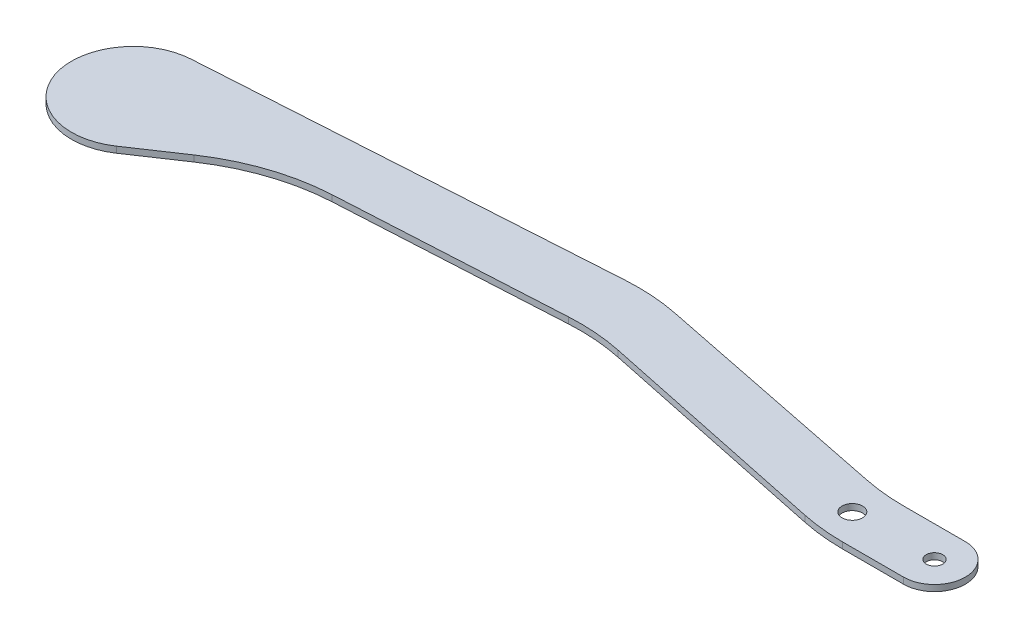
from build123d import *

# Parameters (mm, degrees)
SKETCH1_R           = 5
SKETCH1_R_2         = 4
BOSS_EXTRUDE1_DEPTH = 3
FILLET1_R           = 100


with BuildPart() as part:
    # Sketch1 → Boss-Extrude1 (new body)
    with BuildSketch(Plane(origin=(0, 0, 0), x_dir=(1, 0, 0), z_dir=(0, 1, 0))):
        with BuildLine():
            Line((-138.053278996, 13.889014505), (-5.919683, -13.782501703))
            Line((-5.919683, -13.782501703), (0, -15))
            Line((0, -15), (40, -15))
            ThreePointArc((40, -15), (55, 0), (40, 15))
            Line((40, 15), (0, 15))
            Line((0, 15), (-139.784941349, 43.225909045))
            Line((-139.784941349, 43.225909045), (-351.875415017, 29.941322925))
            ThreePointArc((-351.875415017, 29.941322925), (-378.412739548, -9.628926804), (-333.285739517, -24.912516864))
            Line((-333.285739517, -24.912516864), (-287.823465989, 5.588948968))
            Line((-287.823465989, 5.588948968), (-138.053278996, 13.889014505))
        make_face()
        Circle(SKETCH1_R, mode=Mode.SUBTRACT)
        with Locations((40, 0)):
            Circle(SKETCH1_R_2, mode=Mode.SUBTRACT)
    extrude(amount=BOSS_EXTRUDE1_DEPTH)

    # Fillet1
    fillet1_edges = [part.edges().sort_by_distance(p)[0] for p in [
        (0, 1.5, -15),
        (-139.784941349, 1.5, -43.225909045),
        (-138.053278996, 1.5, -13.889014505),
        (-287.823465989, 1.5, -5.588948968),
        (0, 1.5, 15),
    ]]
    fillet(fillet1_edges, radius=FILLET1_R)


solid = part.part
